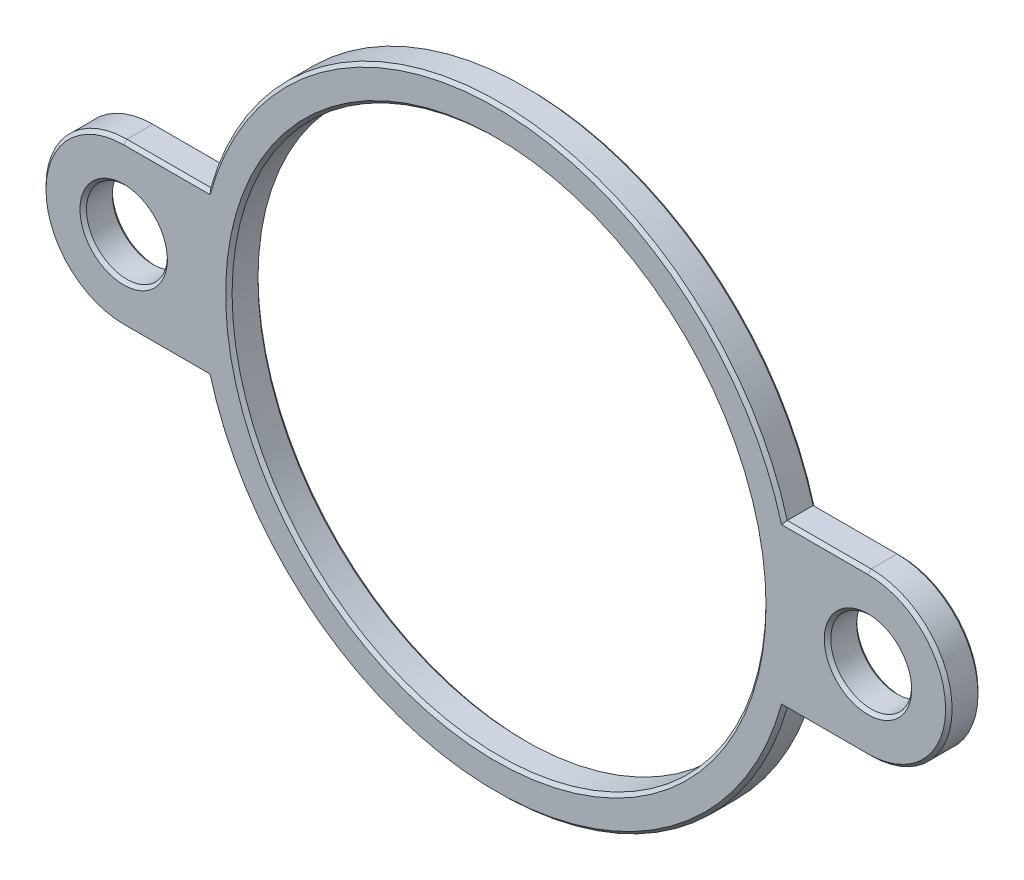
from build123d import *

# Parameters (mm, degrees)
SKETCH_1_R      = 2.5
SKETCH_1_R_2    = 16.5
EXTRUDE_1_DEPTH = 2
CHAMFER_2_SIZE  = 0.2


with BuildPart() as part:
    # Эскиз1 → Бобышка-Вытянуть1 (new body)
    with BuildSketch(Plane.XY):
        with BuildLine():
            Line((23, 5), (17.811513131, 5))
            ThreePointArc((17.811513131, 5), (0, 18.5), (-17.811513131, 5))
            Line((-17.811513131, 5), (-23, 5))
            ThreePointArc((-23, 5), (-28, 0), (-23, -5))
            Line((-23, -5), (-17.811513131, -5))
            ThreePointArc((-17.811513131, -5), (0, -18.5), (17.811513131, -5))
            Line((17.811513131, -5), (23, -5))
            ThreePointArc((23, -5), (28, 0), (23, 5))
        make_face()
        with Locations((23, 0)):
            Circle(SKETCH_1_R, mode=Mode.SUBTRACT)
        with Locations((-23, 0)):
            Circle(SKETCH_1_R, mode=Mode.SUBTRACT)
        Circle(SKETCH_1_R_2, mode=Mode.SUBTRACT)
    extrude(amount=EXTRUDE_1_DEPTH)

    # Фаска2
    chamfer_2_edges = [part.edges().sort_by_distance(p)[0] for p in [
        (-16.5, 0, 2),
        (-25.5, 0, 2),
        (20.5, 0, 2),
        (20.405756565, -5, 2),
        (0, -18.5, 2),
        (-20.405756565, -5, 2),
        (-28, 0, 2),
        (-20.405756565, 5, 2),
        (0, 18.5, 2),
        (20.405756565, 5, 2),
        (28, 0, 2),
        (-16.5, 0, 0),
        (20.5, 0, 0),
        (20.405756565, 5, 0),
        (0, 18.5, 0),
        (-20.405756565, 5, 0),
        (-28, 0, 0),
        (-20.405756565, -5, 0),
        (0, -18.5, 0),
        (20.405756565, -5, 0),
        (28, 0, 0),
        (-25.5, 0, 0),
    ]]
    chamfer(chamfer_2_edges, length=CHAMFER_2_SIZE)


solid = part.part
